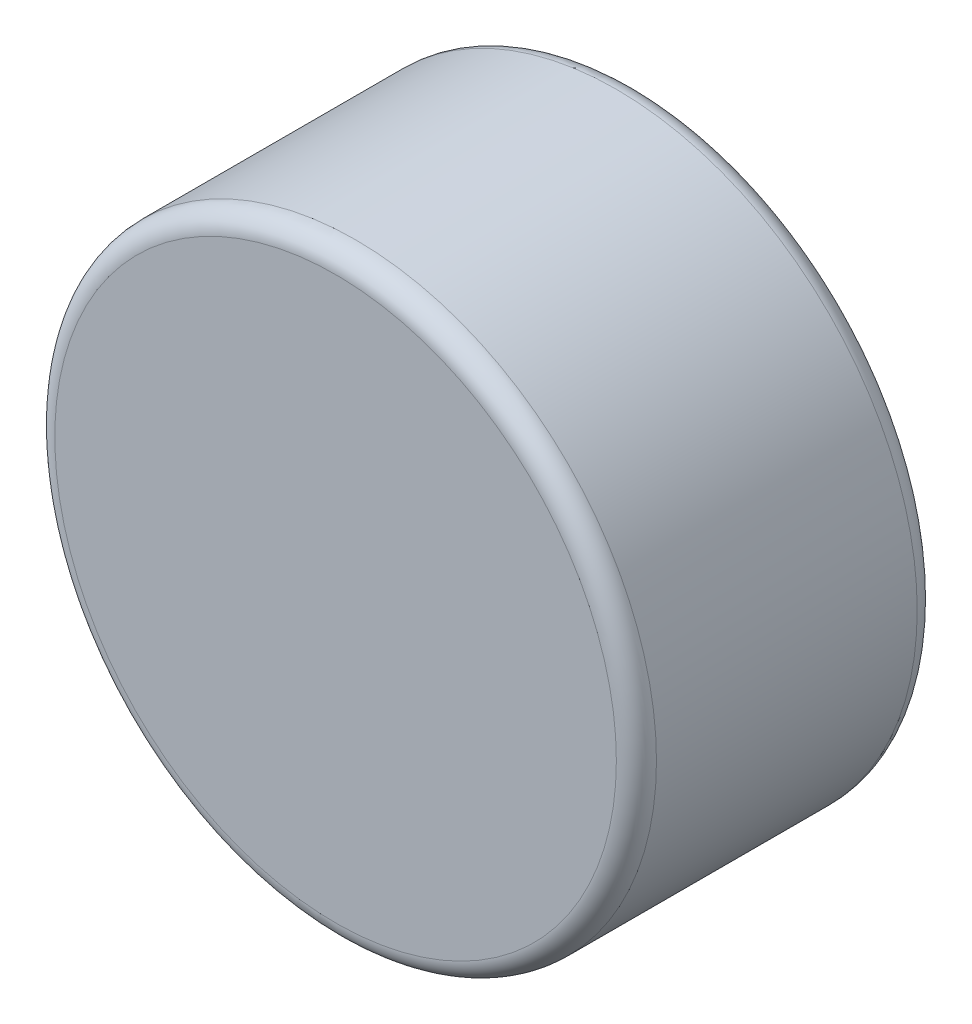
from build123d import *

# Parameters (mm, degrees)
SCHIZZO1_R                   = 3
ESTRUSIONE_ESTRUSIONE1_DEPTH = 3
RACCORDO1_R                  = 0.2


with BuildPart() as part:
    # Schizzo1 → Estrusione-Estrusione1 (new body)
    with BuildSketch(Plane.XY):
        Circle(SCHIZZO1_R)
    extrude(amount=ESTRUSIONE_ESTRUSIONE1_DEPTH)

    # Raccordo1
    raccordo1_edges = [part.edges().sort_by_distance(p)[0] for p in [
        (-3, 0, 0),
        (-3, 0, 3),
    ]]
    fillet(raccordo1_edges, radius=RACCORDO1_R)


solid = part.part
